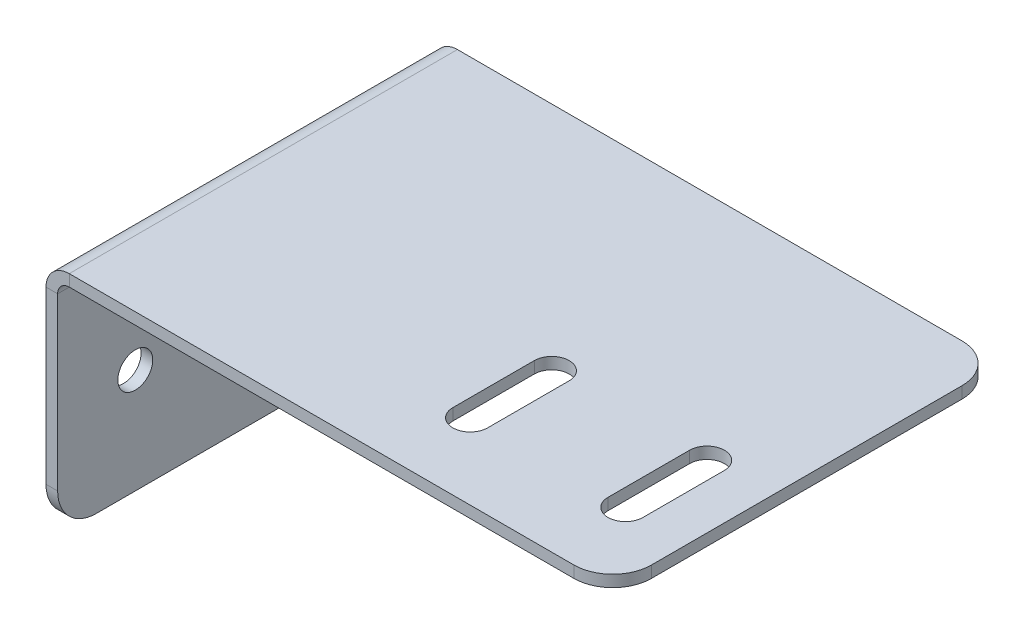
from build123d import *

# Parameters (mm, degrees)
BASE_FLANGE1_DEPTH       = 50
M4_START                 = -1.5
M4_CLEARANCE_SLOT1_DEPTH = 1.5
M4_CLEARANCE_HOLE1_D     = 4.5
FILLET1_R                = 5


# Read off the part's stored shape, not the designer's step: M4 Clearance Slot1
# Sheet-metal steps are written as plain solids
with BuildPart() as part:
    # Sketch1 → Base-Flange1 (new body)
    with BuildSketch(Plane.XY):
        with BuildLine():
            Line((73, 0), (3, 0))
            ThreePointArc((3, 0), (0.878679656, -0.878679656), (0, -3))
            Line((0, -3), (0, -30))
            Line((0, -30), (1.5, -30))
            Line((1.5, -30), (1.5, -3))
            ThreePointArc((1.5, -3), (1.939339828, -1.939339828), (3, -1.5))
            Line((3, -1.5), (73, -1.5))
            Line((73, -1.5), (73, 0))
        make_face()
    extrude(amount=BASE_FLANGE1_DEPTH)

    # M4 Clearance Slot1 outline → M4 Clearance Slot1 (cut)
    with BuildSketch(Plane(origin=(0, 0, 0), x_dir=(1, 0, 0), z_dir=(0, 1, 0)).offset(M4_START)):
        with BuildLine():
            Line((47.15, -40.25), (47.15, -29.75))
            ThreePointArc((47.15, -29.75), (44.9, -27.5), (42.65, -29.75))
            Line((42.65, -29.75), (42.65, -40.25))
            ThreePointArc((42.65, -40.25), (44.9, -42.5), (47.15, -40.25))
        make_face()
        with BuildLine():
            Line((67.15, -40.25), (67.15, -29.75))
            ThreePointArc((67.15, -29.75), (64.9, -27.5), (62.65, -29.75))
            Line((62.65, -29.75), (62.65, -40.25))
            ThreePointArc((62.65, -40.25), (64.9, -42.5), (67.15, -40.25))
        make_face()
    extrude(amount=M4_CLEARANCE_SLOT1_DEPTH, mode=Mode.SUBTRACT)

    # M4 Clearance Hole1 (through all)
    with Locations(Plane(origin=(1.5, 0, 0), x_dir=(0, 0, -1), z_dir=(1, 0, 0))):
        with Locations((-40, -16.5), (-10, -16.5)):
            Hole(M4_CLEARANCE_HOLE1_D / 2)

    # Fillet1
    fillet1_edges = [part.edges().sort_by_distance(p)[0] for p in [
        (73, -0.75, 50),
        (73, -0.75, 0),
        (0.75, -30, 50),
        (0.75, -30, 0),
    ]]
    fillet(fillet1_edges, radius=FILLET1_R)


solid = part.part
